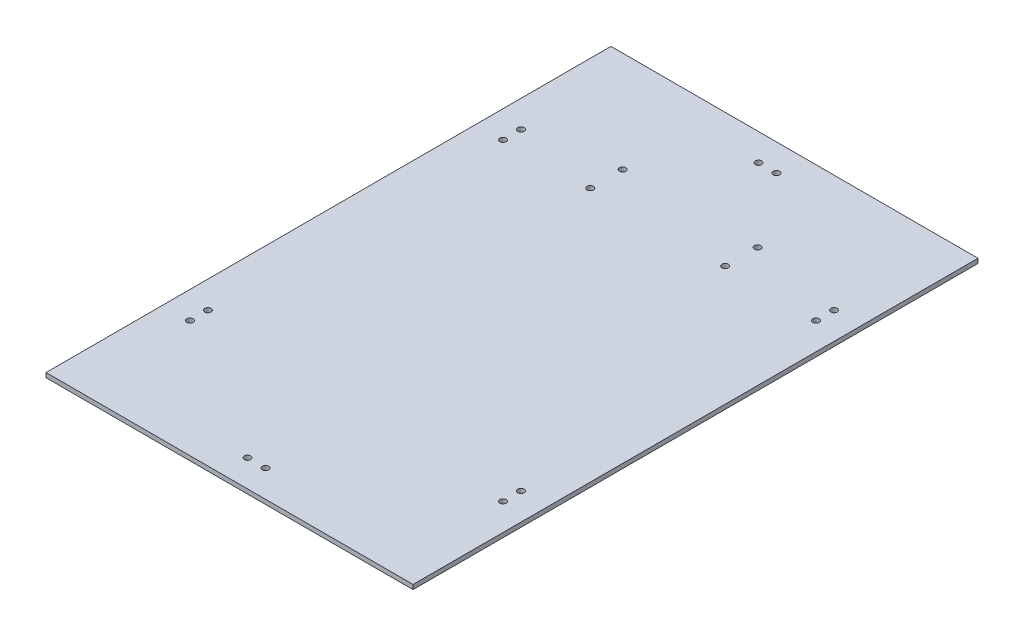
from build123d import *

# Parameters (mm, degrees)
SKETCH1_W             = 259.08
SKETCH1_H             = 398.78
BOSS_EXTRUDE1_DEPTH   = 3.175
F_8_CLEARANCE_HOLE1_D = 4.4958
F_8_CLEARANCE_HOLE2_D = 4.4958


with BuildPart() as part:
    # Sketch1 → Boss-Extrude1 (new body)
    with BuildSketch(Plane(origin=(0, 0, 0), x_dir=(1, 0, 0), z_dir=(0, 1, 0))):
        with Locations((-129.54, -199.39)):
            Rectangle(SKETCH1_W, SKETCH1_H)
    extrude(amount=BOSS_EXTRUDE1_DEPTH)

    # #8 Clearance Hole1 (through all)
    with Locations(Plane(origin=(0, 0, 0), x_dir=(-1, 0, 0), z_dir=(0, -1, 0))):
        with Locations((84.455, -71.12), (84.455, -93.98), (179.705, -93.98), (179.705, -71.12)):
            Hole(F_8_CLEARANCE_HOLE1_D / 2)

    # #8 Clearance Hole2 (through all)
    with Locations(Plane(origin=(0, 0, 0), x_dir=(-1, 0, 0), z_dir=(0, -1, 0))):
        with Locations((19.05, -82.55), (135.89, -19.05), (240.03, -82.55), (240.03, -316.23), (123.19, -19.05), (19.05, -316.23), (240.03, -303.53), (240.03, -95.25), (19.05, -95.25), (19.05, -303.53), (123.19, -379.73), (135.89, -379.73)):
            Hole(F_8_CLEARANCE_HOLE2_D / 2)


solid = part.part
